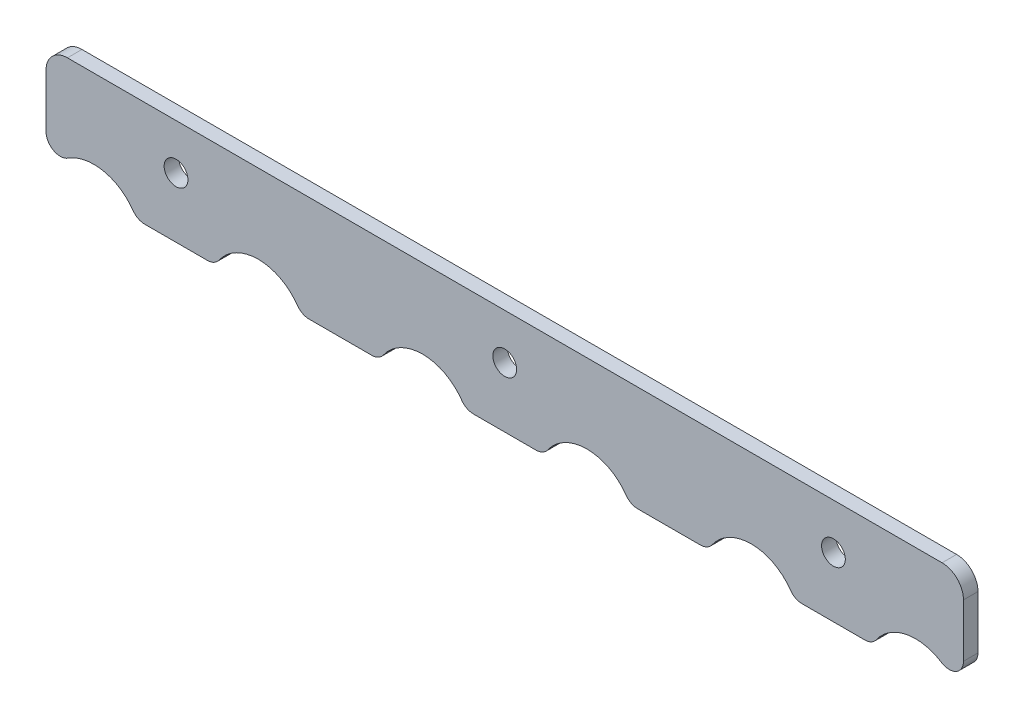
from build123d import *

# Parameters (mm, degrees)
BOSS_EXTRUDE1_DEPTH = 2.032
FILLET1_R           = 3
FILLET2_R           = 2
SKETCH4_R           = 1.6637
CUT_EXTRUDE1_DEPTH  = 136.528598113


with BuildPart() as part:
    # Sketch3 → Boss-Extrude1 (new body)
    with BuildSketch(Plane.XY):
        with BuildLine():
            ThreePointArc((4.075, 10.775), (9.233659082, 17.295296632), (16.76582632, 13.775))
            Line((16.76582632, 13.775), (27.78417368, 13.775))
            ThreePointArc((27.78417368, 13.775), (33.775, 17.475), (39.76582632, 13.775))
            Line((39.76582632, 13.775), (50.78417368, 13.775))
            ThreePointArc((50.78417368, 13.775), (56.775, 17.475), (62.76582632, 13.775))
            Line((62.76582632, 13.775), (73.78417368, 13.775))
            ThreePointArc((73.78417368, 13.775), (79.775, 17.475), (85.76582632, 13.775))
            Line((85.76582632, 13.775), (96.78417368, 13.775))
            ThreePointArc((96.78417368, 13.775), (102.775, 17.475), (108.76582632, 13.775))
            Line((108.76582632, 13.775), (119.78417368, 13.775))
            ThreePointArc((119.78417368, 13.775), (127.316340918, 17.295296632), (132.475, 10.775))
            Line((132.475, 10.775), (132.475, 28.535))
            Line((132.475, 28.535), (4.075, 28.535))
            Line((4.075, 28.535), (4.075, 10.775))
        make_face()
    extrude(amount=BOSS_EXTRUDE1_DEPTH)

    # Fillet1
    fillet1_edges = [part.edges().sort_by_distance(p)[0] for p in [
        (4.075, 28.535, 1.016),
        (132.475, 28.535, 1.016),
    ]]
    fillet(fillet1_edges, radius=FILLET1_R)

    # Fillet2
    fillet2_edges = [part.edges().sort_by_distance(p)[0] for p in [
        (119.78417368, 13.775, 1.016),
    ]]
    fillet(fillet2_edges, radius=FILLET2_R)
    fillet2_2_edges = [part.edges().sort_by_distance(p)[0] for p in [
        (108.76582632, 13.775, 1.016),
    ]]
    fillet(fillet2_2_edges, radius=FILLET2_R)
    fillet2_3_edges = [part.edges().sort_by_distance(p)[0] for p in [
        (96.78417368, 13.775, 1.016),
    ]]
    fillet(fillet2_3_edges, radius=FILLET2_R)
    fillet2_4_edges = [part.edges().sort_by_distance(p)[0] for p in [
        (4.075, 10.775, 1.016),
    ]]
    fillet(fillet2_4_edges, radius=FILLET2_R)
    fillet2_5_edges = [part.edges().sort_by_distance(p)[0] for p in [
        (85.76582632, 13.775, 1.016),
    ]]
    fillet(fillet2_5_edges, radius=FILLET2_R)
    fillet2_6_edges = [part.edges().sort_by_distance(p)[0] for p in [
        (16.76582632, 13.775, 1.016),
    ]]
    fillet(fillet2_6_edges, radius=FILLET2_R)
    fillet2_7_edges = [part.edges().sort_by_distance(p)[0] for p in [
        (73.78417368, 13.775, 1.016),
    ]]
    fillet(fillet2_7_edges, radius=FILLET2_R)
    fillet2_8_edges = [part.edges().sort_by_distance(p)[0] for p in [
        (27.78417368, 13.775, 1.016),
    ]]
    fillet(fillet2_8_edges, radius=FILLET2_R)
    fillet2_9_edges = [part.edges().sort_by_distance(p)[0] for p in [
        (62.76582632, 13.775, 1.016),
    ]]
    fillet(fillet2_9_edges, radius=FILLET2_R)
    fillet2_10_edges = [part.edges().sort_by_distance(p)[0] for p in [
        (39.76582632, 13.775, 1.016),
    ]]
    fillet(fillet2_10_edges, radius=FILLET2_R)
    fillet2_11_edges = [part.edges().sort_by_distance(p)[0] for p in [
        (50.78417368, 13.775, 1.016),
    ]]
    fillet(fillet2_11_edges, radius=FILLET2_R)
    fillet2_12_edges = [part.edges().sort_by_distance(p)[0] for p in [
        (132.475, 10.775, 1.016),
    ]]
    fillet(fillet2_12_edges, radius=FILLET2_R)

    # Sketch4 → Cut-Extrude1 (cut, through all)
    with BuildSketch(Plane(origin=(0, 0, 0), x_dir=(-1, 0, 0), z_dir=(0, 0, -1))):
        with Locations((-22.275, 22.185)):
            Circle(SKETCH4_R)
        with Locations((-68.275, 22.185)):
            Circle(SKETCH4_R)
        with Locations((-114.275, 22.185)):
            Circle(SKETCH4_R)
    extrude(amount=-CUT_EXTRUDE1_DEPTH, mode=Mode.SUBTRACT)


solid = part.part
